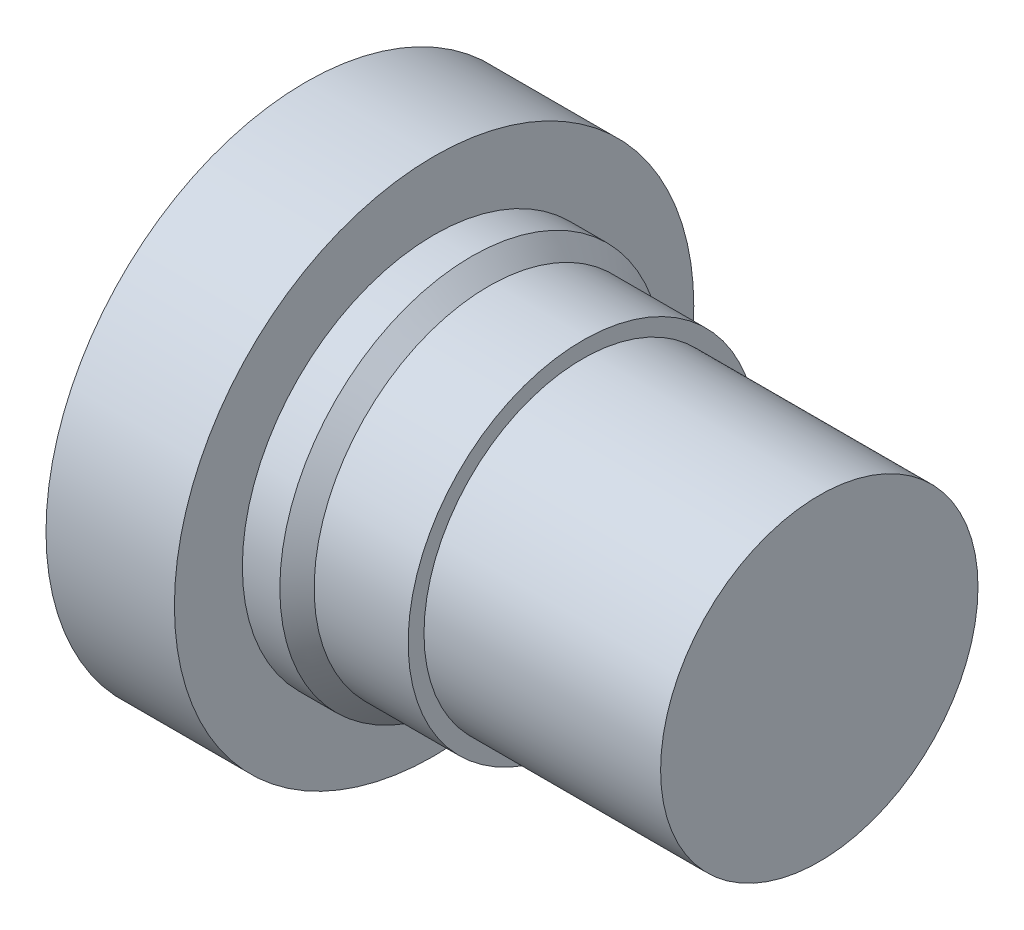
from build123d import *

# Parameters (mm, degrees)
SKETCH2_R          = 7
CUT_EXTRUDE1_DEPTH = 0.0001
DOME1_FACE_RADIUS  = 7
DOME1_HEIGHT       = 1.4


with BuildPart() as part:
    # Sketch1 → Revolve1 (revolve)
    with BuildSketch(Plane.XY):
        Polygon((0, 0), (0, 9), (4.45, 9), (4.45, 6.645190381), (5.748597194, 6.645190381), (6.343787575, 6.05), (9.6, 6.05), (9.6, 5.5), (17.8, 5.5), (17.8, 0), align=None)
    revolve(axis=Axis((17.8, 0, 0), (-1, 0, 0)))

    # Sketch2 → Cut-Extrude1 (cut)
    with BuildSketch(Plane.ZY):
        Circle(SKETCH2_R)
    extrude(amount=-CUT_EXTRUDE1_DEPTH, mode=Mode.SUBTRACT)

    # Dome1: an elliptical dome of height H over a round flat face of radius A is half a spheroid: the quarter ellipse of half axes A and H revolved about the face's axis
    with BuildSketch(Plane((0.0001, 0, 0), x_dir=(0, 0, -1), z_dir=(0, 1, 0)), mode=Mode.PRIVATE) as dome1_quarter:
        Ellipse(DOME1_FACE_RADIUS, DOME1_HEIGHT)
        Rectangle(DOME1_FACE_RADIUS, DOME1_HEIGHT, align=(Align.MIN, Align.MIN), mode=Mode.INTERSECT)
    revolve(dome1_quarter.sketch, axis=Axis((0.0001, 0, 0), (-1, 0, 0)))


solid = part.part
